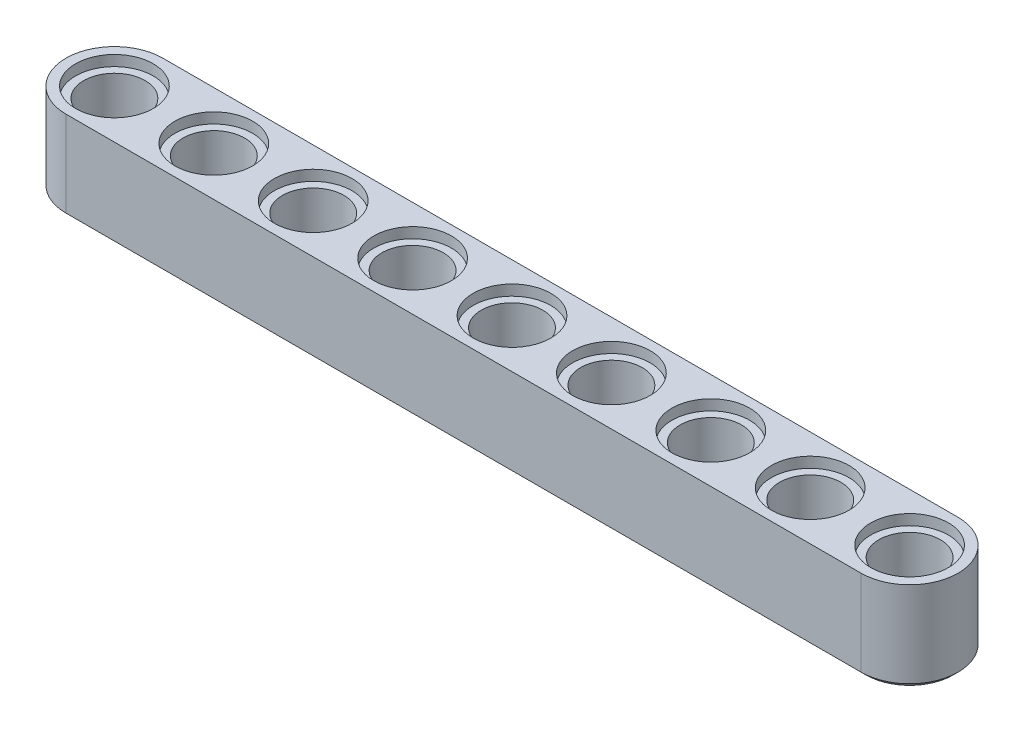
from build123d import *

# Parameters (mm, degrees)
BOSS_EXTRUDE1_DEPTH       = 7.3
SKETCH2_R                 = 2.475
CUT_EXTRUDE1_DEPTH        = 69.402558432
SKETCH3_R                 = 3.125
CUT_EXTRUDE2_DEPTH        = 0.85
LPATTERN1_COUNT           = 9
LPATTERN1_PITCH           = 8
LPATTERN1_COPY_1_SKETCH_R = 3.125
LPATTERN1_COPY_1_DEPTH    = 0.85
LPATTERN1_COPY_2_SKETCH_R = 3.125
LPATTERN1_COPY_2_DEPTH    = 0.85
LPATTERN1_COPY_3_SKETCH_R = 3.125
LPATTERN1_COPY_3_DEPTH    = 0.85
LPATTERN1_COPY_4_SKETCH_R = 3.125
LPATTERN1_COPY_4_DEPTH    = 0.85
LPATTERN1_COPY_5_SKETCH_R = 3.125
LPATTERN1_COPY_5_DEPTH    = 0.85
LPATTERN1_COPY_6_SKETCH_R = 3.125
LPATTERN1_COPY_6_DEPTH    = 0.85
LPATTERN1_COPY_7_SKETCH_R = 3.125
LPATTERN1_COPY_7_DEPTH    = 0.85
LPATTERN1_COPY_8_SKETCH_R = 3.125
LPATTERN1_COPY_8_DEPTH    = 0.85
CHAMFER1_SIZE             = 0.4


with BuildPart() as part:
    # Sketch1 → Boss-Extrude1 (new body)
    with BuildSketch(Plane(origin=(0, 0, 0), x_dir=(1, 0, 0), z_dir=(0, 1, 0))):
        with BuildLine():
            Line((0, 3.9), (64, 3.9))
            ThreePointArc((64, 3.9), (67.9, 0), (64, -3.9))
            Line((64, -3.9), (0, -3.9))
            ThreePointArc((0, -3.9), (-3.9, 0), (0, 3.9))
        make_face()
    extrude(amount=BOSS_EXTRUDE1_DEPTH)

    # Sketch2 → Cut-Extrude1 (cut, through all)
    with BuildSketch(Plane(origin=(0, 7.3, 0), x_dir=(1, 0, 0), z_dir=(0, 1, 0))):
        with Locations(Location((0, 0, 0), (0, 0, 270))):
            Circle(SKETCH2_R)
    cut_extrude1 = extrude(amount=-CUT_EXTRUDE1_DEPTH, mode=Mode.SUBTRACT)

    # Sketch3 → Cut-Extrude2 (cut)
    with BuildSketch(Plane(origin=(0, 7.3, 0), x_dir=(1, 0, 0), z_dir=(0, 1, 0))):
        with Locations(Location((0, 0, 0), (0, 0, 270))):
            Circle(SKETCH3_R)
    cut_extrude2 = extrude(amount=-CUT_EXTRUDE2_DEPTH, mode=Mode.SUBTRACT)

    # Mirror1: Cut-Extrude2 across plane
    add(cut_extrude2.mirror(Plane.ZX.offset(3.65)), mode=Mode.SUBTRACT)

    # LPattern1: Cut-Extrude1, Cut-Extrude2 ×9
    with Locations(*[(i * LPATTERN1_PITCH, 0, 0) for i in range(1, LPATTERN1_COUNT)]):
        add(cut_extrude1, mode=Mode.SUBTRACT)
        add(cut_extrude2, mode=Mode.SUBTRACT)

    # LPattern1 copy 1 sketch → LPattern1 copy 1 (cut)
    with BuildSketch(Plane(origin=(8, 0, 0), x_dir=(1, 0, 0), z_dir=(0, -1, 0))):
        Circle(LPATTERN1_COPY_1_SKETCH_R)
    extrude(amount=-LPATTERN1_COPY_1_DEPTH, mode=Mode.SUBTRACT)

    # LPattern1 copy 2 sketch → LPattern1 copy 2 (cut)
    with BuildSketch(Plane(origin=(16, 0, 0), x_dir=(1, 0, 0), z_dir=(0, -1, 0))):
        Circle(LPATTERN1_COPY_2_SKETCH_R)
    extrude(amount=-LPATTERN1_COPY_2_DEPTH, mode=Mode.SUBTRACT)

    # LPattern1 copy 3 sketch → LPattern1 copy 3 (cut)
    with BuildSketch(Plane(origin=(24, 0, 0), x_dir=(1, 0, 0), z_dir=(0, -1, 0))):
        Circle(LPATTERN1_COPY_3_SKETCH_R)
    extrude(amount=-LPATTERN1_COPY_3_DEPTH, mode=Mode.SUBTRACT)

    # LPattern1 copy 4 sketch → LPattern1 copy 4 (cut)
    with BuildSketch(Plane(origin=(32, 0, 0), x_dir=(1, 0, 0), z_dir=(0, -1, 0))):
        Circle(LPATTERN1_COPY_4_SKETCH_R)
    extrude(amount=-LPATTERN1_COPY_4_DEPTH, mode=Mode.SUBTRACT)

    # LPattern1 copy 5 sketch → LPattern1 copy 5 (cut)
    with BuildSketch(Plane(origin=(40, 0, 0), x_dir=(1, 0, 0), z_dir=(0, -1, 0))):
        Circle(LPATTERN1_COPY_5_SKETCH_R)
    extrude(amount=-LPATTERN1_COPY_5_DEPTH, mode=Mode.SUBTRACT)

    # LPattern1 copy 6 sketch → LPattern1 copy 6 (cut)
    with BuildSketch(Plane(origin=(48, 0, 0), x_dir=(1, 0, 0), z_dir=(0, -1, 0))):
        Circle(LPATTERN1_COPY_6_SKETCH_R)
    extrude(amount=-LPATTERN1_COPY_6_DEPTH, mode=Mode.SUBTRACT)

    # LPattern1 copy 7 sketch → LPattern1 copy 7 (cut)
    with BuildSketch(Plane(origin=(56, 0, 0), x_dir=(1, 0, 0), z_dir=(0, -1, 0))):
        Circle(LPATTERN1_COPY_7_SKETCH_R)
    extrude(amount=-LPATTERN1_COPY_7_DEPTH, mode=Mode.SUBTRACT)

    # LPattern1 copy 8 sketch → LPattern1 copy 8 (cut)
    with BuildSketch(Plane(origin=(64, 0, 0), x_dir=(1, 0, 0), z_dir=(0, -1, 0))):
        Circle(LPATTERN1_COPY_8_SKETCH_R)
    extrude(amount=-LPATTERN1_COPY_8_DEPTH, mode=Mode.SUBTRACT)

    # Chamfer1
    # the kernel refuses this chamfer: 0.4 mm, written as the material it takes off along each edge
    with BuildSketch(Plane(origin=(8, 0, 0), x_dir=(1, 0, 0), z_dir=(0, 0, -1))) as chamfer1_piece_1:
        Polygon((3.125 + CHAMFER1_SIZE, 0), (3.125, -CHAMFER1_SIZE), (3.125, 0), align=None)
    revolve(axis=Axis((8, 0, 0), (0, -1, 0)), mode=Mode.SUBTRACT)
    with BuildSketch(Plane(origin=(16, 0, 0), x_dir=(1, 0, 0), z_dir=(0, 0, -1))) as chamfer1_piece_2:
        Polygon((3.125 + CHAMFER1_SIZE, 0), (3.125, -CHAMFER1_SIZE), (3.125, 0), align=None)
    revolve(axis=Axis((16, 0, 0), (0, -1, 0)), mode=Mode.SUBTRACT)
    with BuildSketch(Plane(origin=(24, 0, 0), x_dir=(1, 0, 0), z_dir=(0, 0, -1))) as chamfer1_piece_3:
        Polygon((3.125 + CHAMFER1_SIZE, 0), (3.125, -CHAMFER1_SIZE), (3.125, 0), align=None)
    revolve(axis=Axis((24, 0, 0), (0, -1, 0)), mode=Mode.SUBTRACT)
    with BuildSketch(Plane(origin=(32, 0, 0), x_dir=(1, 0, 0), z_dir=(0, 0, -1))) as chamfer1_piece_4:
        Polygon((3.125 + CHAMFER1_SIZE, 0), (3.125, -CHAMFER1_SIZE), (3.125, 0), align=None)
    revolve(axis=Axis((32, 0, 0), (0, -1, 0)), mode=Mode.SUBTRACT)
    with BuildSketch(Plane(origin=(40, 0, 0), x_dir=(1, 0, 0), z_dir=(0, 0, -1))) as chamfer1_piece_5:
        Polygon((3.125 + CHAMFER1_SIZE, 0), (3.125, -CHAMFER1_SIZE), (3.125, 0), align=None)
    revolve(axis=Axis((40, 0, 0), (0, -1, 0)), mode=Mode.SUBTRACT)
    with BuildSketch(Plane(origin=(48, 0, 0), x_dir=(1, 0, 0), z_dir=(0, 0, -1))) as chamfer1_piece_6:
        Polygon((3.125 + CHAMFER1_SIZE, 0), (3.125, -CHAMFER1_SIZE), (3.125, 0), align=None)
    revolve(axis=Axis((48, 0, 0), (0, -1, 0)), mode=Mode.SUBTRACT)
    with BuildSketch(Plane(origin=(56, 0, 0), x_dir=(1, 0, 0), z_dir=(0, 0, -1))) as chamfer1_piece_7:
        Polygon((3.125 + CHAMFER1_SIZE, 0), (3.125, -CHAMFER1_SIZE), (3.125, 0), align=None)
    revolve(axis=Axis((56, 0, 0), (0, -1, 0)), mode=Mode.SUBTRACT)
    with BuildSketch(Plane(origin=(64, 0, 0), x_dir=(1, 0, 0), z_dir=(0, 0, -1))) as chamfer1_piece_8:
        Polygon((3.125 + CHAMFER1_SIZE, 0), (3.125, -CHAMFER1_SIZE), (3.125, 0), align=None)
    revolve(axis=Axis((64, 0, 0), (0, -1, 0)), mode=Mode.SUBTRACT)
    with BuildSketch(Plane(origin=(0, 0, 0), x_dir=(0, 0, 1), z_dir=(-1, 0, 0))) as chamfer1_piece_9:
        Polygon((3.125 + CHAMFER1_SIZE, 0), (3.125, CHAMFER1_SIZE), (3.125, 0), align=None)
    revolve(axis=Axis((0, 0, 0), (0, 1, 0)), mode=Mode.SUBTRACT)
    with BuildSketch(Plane(origin=(0, 0, -3.9), x_dir=(0, -0.027495876610586386, 0.9996219169112968), z_dir=(1, 0, 0))) as chamfer1_piece_10:
        Polygon((CHAMFER1_SIZE * 0.999621916911, -CHAMFER1_SIZE * 0.0274958766106), (-CHAMFER1_SIZE * 0.0274958766106, -CHAMFER1_SIZE * 0.999621916911), (0, 0), align=None)
    extrude(amount=64, mode=Mode.SUBTRACT)
    with BuildSketch(Plane(origin=(64, 0, 0), x_dir=(0, 0, -1), z_dir=(-1, 0, 0))) as chamfer1_piece_11:
        Polygon((3.9, -CHAMFER1_SIZE), (3.9 - CHAMFER1_SIZE, 0), (3.9, 0), align=None)
    revolve(axis=Axis((64, 0, 0), (0, -1, 0)), revolution_arc=180, mode=Mode.SUBTRACT)
    with BuildSketch(Plane(origin=(64, 0, 3.9), x_dir=(0, 0.9996219169112968, 0.027495876610586275), z_dir=(-1, 0, 0))) as chamfer1_piece_12:
        Polygon((CHAMFER1_SIZE * 0.999621916911, CHAMFER1_SIZE * 0.0274958766106), (-CHAMFER1_SIZE * 0.0274958766106, CHAMFER1_SIZE * 0.999621916911), (0, 0), align=None)
    extrude(amount=64, mode=Mode.SUBTRACT)
    with BuildSketch(Plane(origin=(0, 0, 0), x_dir=(0, 0, 1), z_dir=(1, 0, 0))) as chamfer1_piece_13:
        Polygon((3.9, -CHAMFER1_SIZE), (3.9 - CHAMFER1_SIZE, 0), (3.9, 0), align=None)
    revolve(axis=Axis((0, 0, 0), (0, -1, 0)), revolution_arc=180, mode=Mode.SUBTRACT)


solid = part.part
